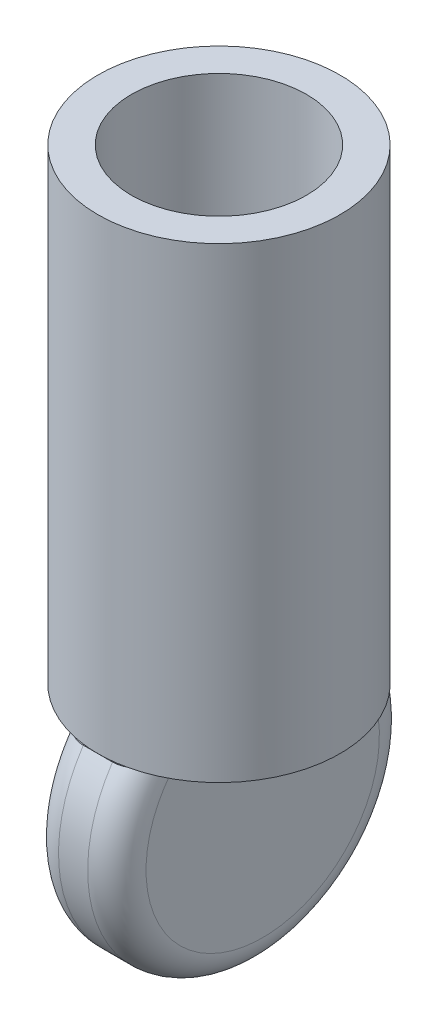
from build123d import *

# Parameters (mm, degrees)
SKETCH1_R           = 4.15
SKETCH1_R_2         = 3
BOSS_EXTRUDE1_DEPTH = 14
BOSS_EXTRUDE2_START = -2
SKETCH1_2_R         = 4.15
SKETCH1_2_R_2       = 3
BOSS_EXTRUDE2_DEPTH = 2
BOSS_EXTRUDE3_DEPTH = 1.5
FILLET1_R           = 1


with BuildPart() as part:
    # Sketch1 → Boss-Extrude1 (new body)
    with BuildSketch(Plane(origin=(0, 0, 0), x_dir=(1, 0, 0), z_dir=(0, 1, 0))):
        with Locations(Location((0, 0, 0), (0, 0, 270))):
            Circle(SKETCH1_R)
        with Locations(Location((0, 0, 0), (0, 0, 270))):
            Circle(SKETCH1_R_2, mode=Mode.SUBTRACT)
    extrude(amount=BOSS_EXTRUDE1_DEPTH)

    # Sketch1<2> → Boss-Extrude2 (add)
    # profile 1 of 2: a face of its own
    with BuildSketch(Plane(origin=(0, 0, 0), x_dir=(1, 0, 0), z_dir=(0, 1, 0)).offset(BOSS_EXTRUDE2_START)):
        with Locations(Location((0, 0, 0), (0, 0, 270))):
            Circle(SKETCH1_2_R)
        with Locations(Location((0, 0, 0), (0, 0, 270))):
            Circle(SKETCH1_2_R_2, mode=Mode.SUBTRACT)
    # profile 2 of 2: a face of its own
    with BuildSketch(Plane(origin=(0, 0, 0), x_dir=(1, 0, 0), z_dir=(0, 1, 0)).offset(BOSS_EXTRUDE2_START)):
        with Locations(Location((0, 0, 0), (0, 0, 270))):
            Circle(SKETCH1_2_R_2)
    extrude(amount=BOSS_EXTRUDE2_DEPTH)

    # Sketch3 → Boss-Extrude3 (add, symmetric)
    with BuildSketch(Plane(origin=(0, 0, 0), x_dir=(0, 0, -1), z_dir=(1, 0, 0))):
        with BuildLine():
            Line((-4.15, -2), (4.15, -2))
            ThreePointArc((4.15, -2), (0, -9.788816953), (-4.15, -2))
        make_face()
    extrude(amount=BOSS_EXTRUDE3_DEPTH, both=True)

    # Fillet1
    # the kernel refuses this fillet: 1 mm, written as the material it takes off along each edge
    with BuildSketch(Plane(origin=(-1.5, -4.788816953, 0), x_dir=(0, 0.8881088245588202, -0.45963324046542875), z_dir=(0, 0.45963324046542875, 0.8881088245588202))) as fillet1_piece_1_section:
        with BuildLine():
            CenterArc((5 - FILLET1_R, -FILLET1_R), FILLET1_R, 0, 90)
            Line((5 - FILLET1_R, 0), (5, 0))
            Line((5, 0), (5, -FILLET1_R))
        make_face()
    fillet1_piece_1 = revolve(axis=Axis((-1.5, -4.788816953, 0), (-1, 0, 0)), revolution_arc=305.273112573, mode=Mode.PRIVATE)
    fillet1_piece_1 = split(fillet1_piece_1, bisect_by=Plane(origin=(-1.219469411, -2, 0), z_dir=(0, -1, 0)), keep=Keep.TOP, mode=Mode.PRIVATE)
    add(fillet1_piece_1, mode=Mode.SUBTRACT)
    with BuildSketch(Plane(origin=(1.5, -4.788816953, 0), x_dir=(0, 0.8881088245588202, -0.45963324046542875), z_dir=(0, 0.45963324046542875, 0.8881088245588202))) as fillet1_piece_2_section:
        with BuildLine():
            CenterArc((5 - FILLET1_R, FILLET1_R), FILLET1_R, 270, 90)
            Line((5 - FILLET1_R, 0), (5, 0))
            Line((5, 0), (5, FILLET1_R))
        make_face()
    fillet1_piece_2 = revolve(axis=Axis((1.5, -4.788816953, 0), (-1, 0, 0)), revolution_arc=305.273112573, mode=Mode.PRIVATE)
    fillet1_piece_2 = split(fillet1_piece_2, bisect_by=Plane(origin=(1.219469411, -2, 0), z_dir=(0, -1, 0)), keep=Keep.TOP, mode=Mode.PRIVATE)
    add(fillet1_piece_2, mode=Mode.SUBTRACT)


solid = part.part
